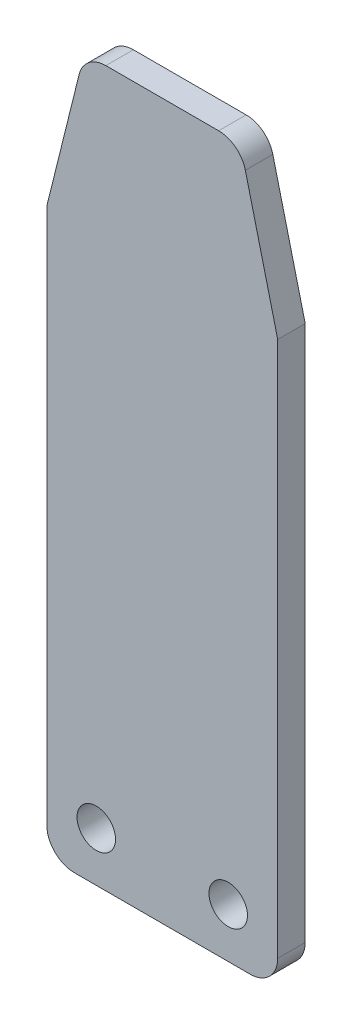
from build123d import *

# Parameters (mm, degrees)
SKETCH1_R           = 7
BOSS_EXTRUDE1_DEPTH = 10


with BuildPart() as part:
    # Sketch1 → Boss-Extrude1 (new body)
    with BuildSketch(Plane.XY):
        with BuildLine():
            Line((-20.517714388, 260), (20.517714388, 260))
            ThreePointArc((20.517714388, 260), (26.67774114, 257.877440601), (30.222763355, 252.410814084))
            Line((30.222763355, 252.410814084), (42, 205))
            Line((42, 205), (42, 10))
            ThreePointArc((42, 10), (39.071067812, 2.928932188), (32, 0))
            Line((32, 0), (-32, 0))
            ThreePointArc((-32, 0), (-39.071067812, 2.928932188), (-42, 10))
            Line((-42, 10), (-42, 205))
            Line((-42, 205), (-30.222763355, 252.410814084))
            ThreePointArc((-30.222763355, 252.410814084), (-26.67774114, 257.877440601), (-20.517714388, 260))
        make_face()
        with Locations((24, 18)):
            Circle(SKETCH1_R, mode=Mode.SUBTRACT)
        with Locations((-24, 18)):
            Circle(SKETCH1_R, mode=Mode.SUBTRACT)
    extrude(amount=BOSS_EXTRUDE1_DEPTH)


solid = part.part
